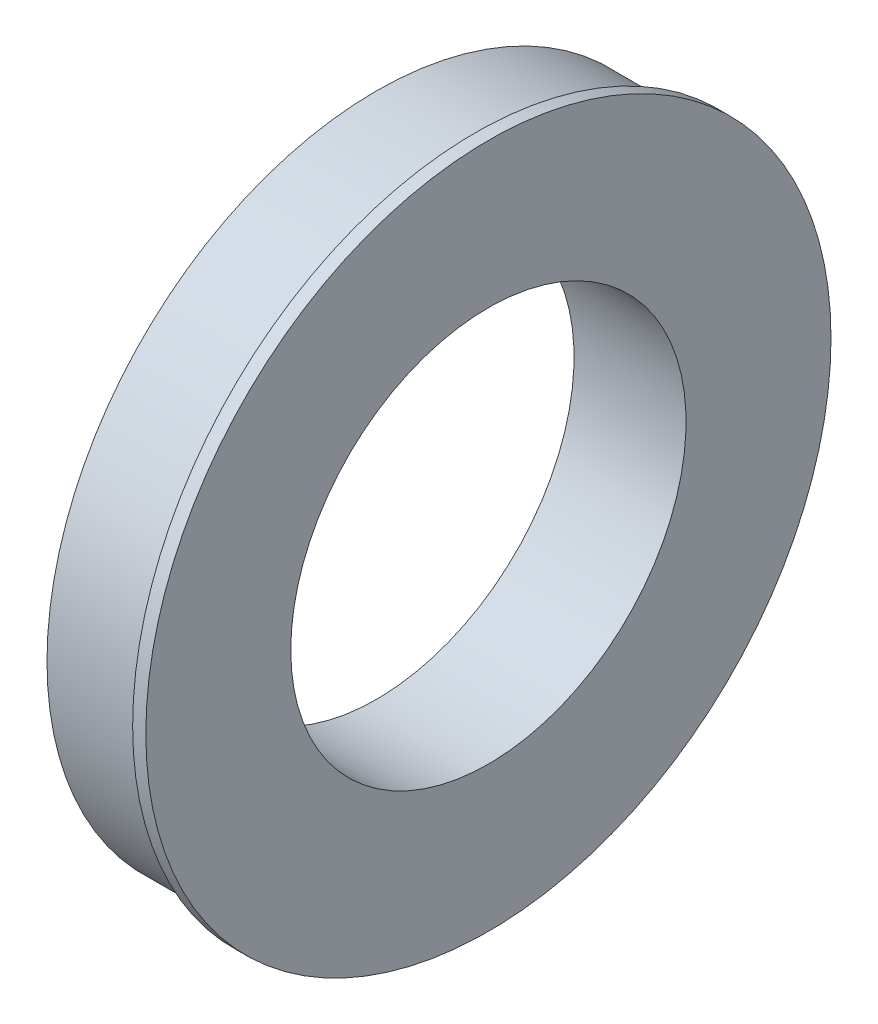
from build123d import *

# Parameters (mm, degrees)
SKETCH1_R           = 63.5
SKETCH1_R_2         = 38.1
BOSS_EXTRUDE1_DEPTH = 19.05
SKETCH2_R           = 66.04
SKETCH2_R_2         = 38.1
BOSS_EXTRUDE2_DEPTH = 2.54


with BuildPart() as part:
    # Sketch1 → Boss-Extrude1 (new body)
    with BuildSketch(Plane(origin=(0, 0, 0), x_dir=(0, 0, -1), z_dir=(1, 0, 0))):
        Circle(SKETCH1_R)
        Circle(SKETCH1_R_2, mode=Mode.SUBTRACT)
    extrude(amount=BOSS_EXTRUDE1_DEPTH)

    # Sketch2 → Boss-Extrude2 (add)
    with BuildSketch(Plane(origin=(19.05, 0, 0), x_dir=(0, 0, -1), z_dir=(1, 0, 0))):
        Circle(SKETCH2_R)
        Circle(SKETCH2_R_2, mode=Mode.SUBTRACT)
    extrude(amount=BOSS_EXTRUDE2_DEPTH)


solid = part.part
